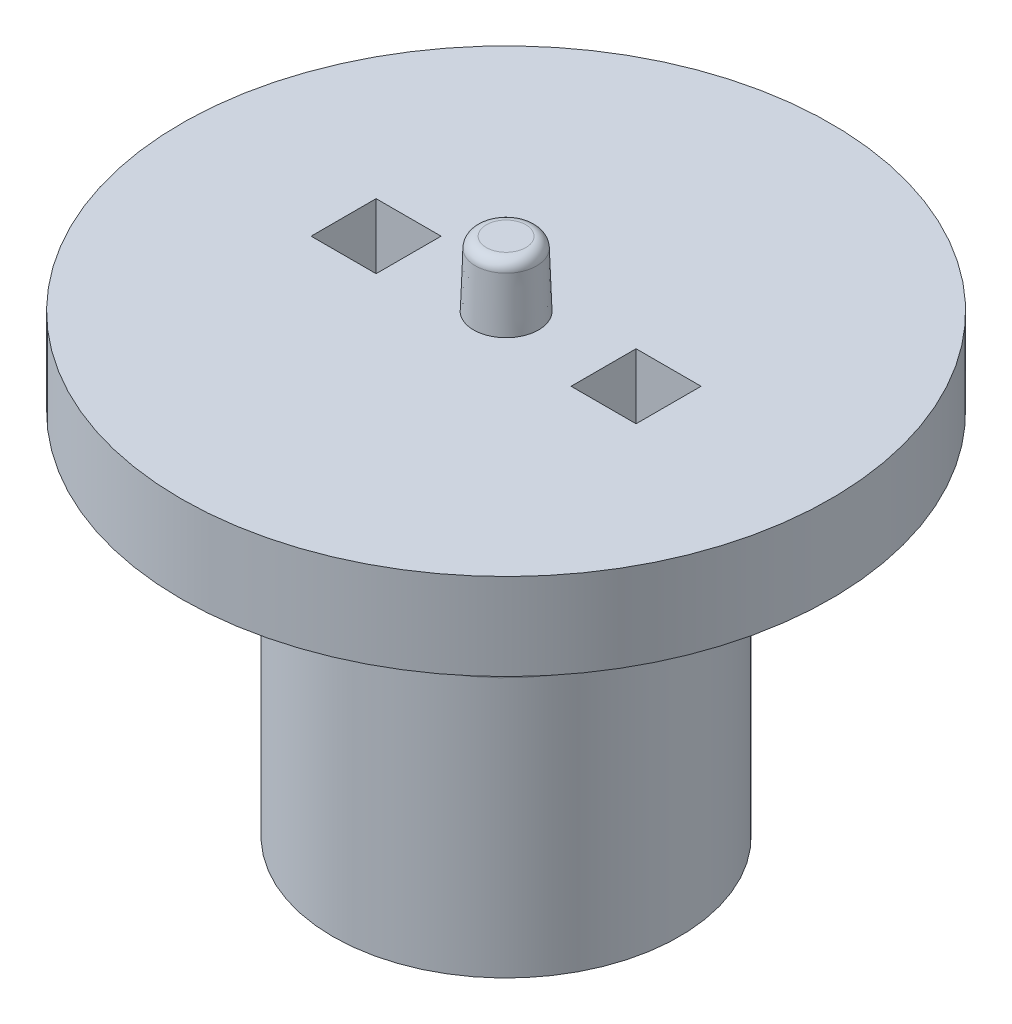
from build123d import *

# Parameters (mm, degrees)
SKETCH1_R           = 8
SKETCH1_R_2         = 2.575
BOSS_EXTRUDE1_DEPTH = 15
SKETCH2_R           = 1.25
CUT_EXTRUDE1_DEPTH  = 19.788294228
SKETCH12_R          = 8
BOSS_EXTRUDE3_DEPTH = 2
SKETCH11_R          = 15
SKETCH11_W          = 3
SKETCH11_H          = 3
BOSS_EXTRUDE2_DEPTH = 4
SKETCH13_R          = 1.5
BOSS_EXTRUDE4_DEPTH = 3
BOSS_EXTRUDE4_TAPER = 2
FILLET2_R           = 0.5
FILLET4_R           = 5


with BuildPart() as part:
    # Sketch1 → Boss-Extrude1 (new body)
    with BuildSketch(Plane(origin=(0, 0, 0), x_dir=(1, 0, 0), z_dir=(0, 1, 0))):
        Circle(SKETCH1_R)
        Circle(SKETCH1_R_2, mode=Mode.SUBTRACT)
    extrude(amount=BOSS_EXTRUDE1_DEPTH)

    # Sketch2 → Cut-Extrude1 (cut, through all)
    with BuildSketch(Plane.XY):
        with Locations((0, 7.5)):
            Circle(SKETCH2_R)
    extrude(amount=-CUT_EXTRUDE1_DEPTH, mode=Mode.SUBTRACT)

    # Sketch12 → Boss-Extrude3 (add)
    with BuildSketch(Plane(origin=(0, 15, 0), x_dir=(1, 0, 0), z_dir=(0, 1, 0))):
        Circle(SKETCH12_R)
    extrude(amount=BOSS_EXTRUDE3_DEPTH)

    # Sketch11 → Boss-Extrude2 (add)
    with BuildSketch(Plane(origin=(0, 17, 0), x_dir=(1, 0, 0), z_dir=(0, 1, 0))):
        Circle(SKETCH11_R)
        with Locations((-6, 0)):
            Rectangle(SKETCH11_W, SKETCH11_H, mode=Mode.SUBTRACT)
        with Locations((6, 0)):
            Rectangle(SKETCH11_W, SKETCH11_H, mode=Mode.SUBTRACT)
    extrude(amount=BOSS_EXTRUDE2_DEPTH)

    # Sketch13 → Boss-Extrude4 (add)
    with BuildSketch(Plane(origin=(0, 21, 0), x_dir=(1, 0, 0), z_dir=(0, 1, 0))):
        Circle(SKETCH13_R)
    extrude(amount=BOSS_EXTRUDE4_DEPTH, taper=BOSS_EXTRUDE4_TAPER)

    # Fillet2
    fillet2_edges = [part.edges().sort_by_distance(p)[0] for p in [
        (-1.395237692, 24, 0),
    ]]
    fillet(fillet2_edges, radius=FILLET2_R)

    # Fillet4
    fillet4_edges = [part.edges().sort_by_distance(p)[0] for p in [
        (-8, 17, 0),
    ]]
    fillet(fillet4_edges, radius=FILLET4_R)


solid = part.part
